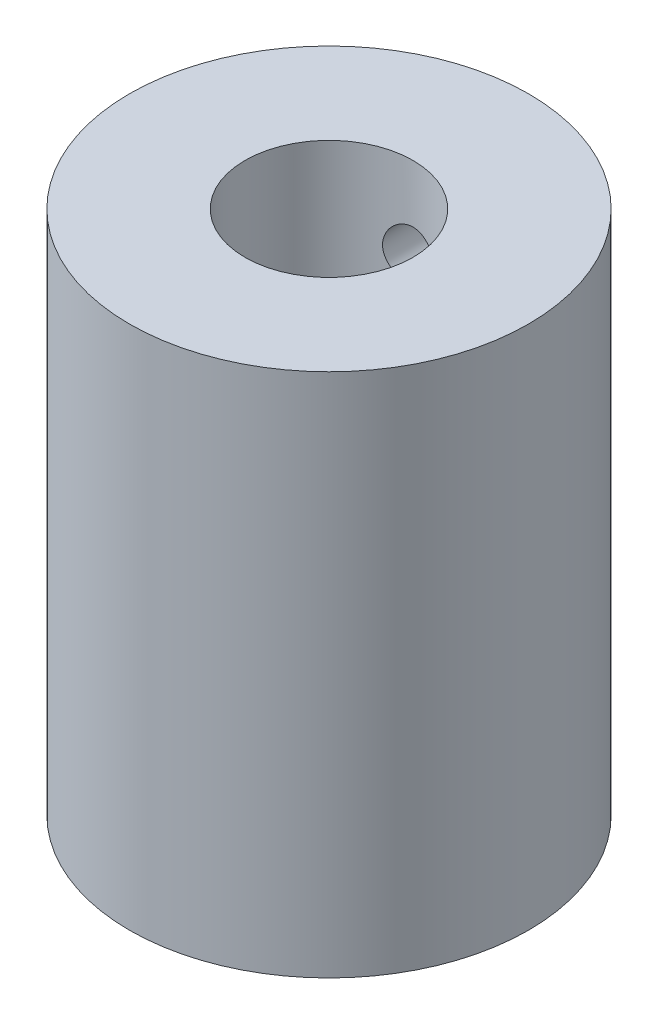
from build123d import *

# Parameters (mm, degrees)
SKETCH1_R           = 9.5
BOSS_EXTRUDE1_DEPTH = 25
SKETCH2_R           = 4
CUT_EXTRUDE1_DEPTH  = 12.5
SKETCH3_R           = 2.5
CUT_EXTRUDE2_DEPTH  = 12.5
SKETCH4_R           = 1.25
CUT_EXTRUDE3_DEPTH  = 12.5


with BuildPart() as part:
    # Sketch1 → Boss-Extrude1 (new body)
    with BuildSketch(Plane(origin=(0, 0, 0), x_dir=(1, 0, 0), z_dir=(0, 1, 0))):
        Circle(SKETCH1_R)
    extrude(amount=BOSS_EXTRUDE1_DEPTH)

    # Sketch2 → Cut-Extrude1 (cut)
    with BuildSketch(Plane(origin=(0, 25, 0), x_dir=(1, 0, 0), z_dir=(0, 1, 0))):
        Circle(SKETCH2_R)
    extrude(amount=-CUT_EXTRUDE1_DEPTH, mode=Mode.SUBTRACT)

    # Sketch3 → Cut-Extrude2 (cut)
    with BuildSketch(Plane.XZ):
        Circle(SKETCH3_R)
    extrude(amount=-CUT_EXTRUDE2_DEPTH, mode=Mode.SUBTRACT)

    # Sketch4 → Cut-Extrude3 (cut)
    with BuildSketch(Plane.XY):
        with Locations((0, 4)):
            Circle(SKETCH4_R)
        with Locations((0, 21)):
            Circle(SKETCH4_R)
    extrude(amount=-CUT_EXTRUDE3_DEPTH, mode=Mode.SUBTRACT)


solid = part.part
